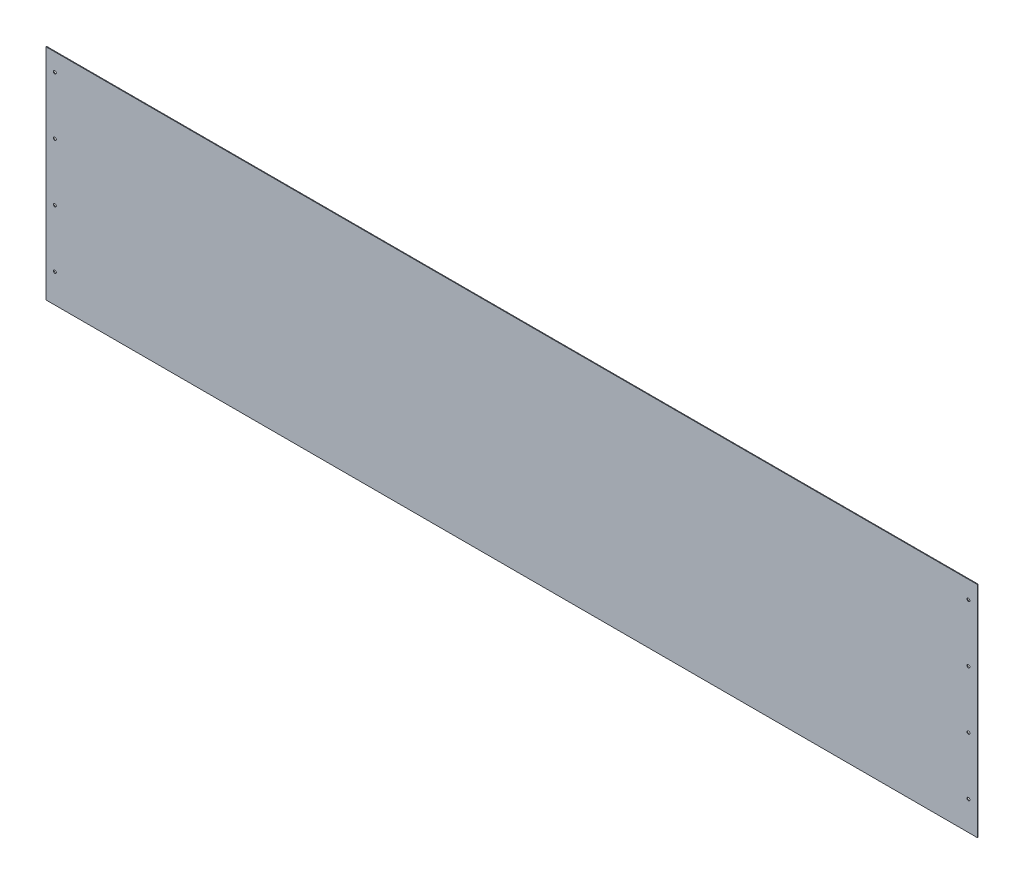
from build123d import *

# Parameters (mm, degrees)
CROQUIS1_W                   = 2103.98
CROQUIS1_H                   = 495.4
BRIDA_BASE1_DEPTH            = 1.5875
TALADRO_DE_MARGEN_PARA_M61_D = 6.6


# Sheet-metal steps are written as plain solids
with BuildPart() as part:
    # Croquis1 → Brida base1 (new body)
    with BuildSketch(Plane.XY):
        Rectangle(CROQUIS1_W, CROQUIS1_H)
    extrude(amount=-BRIDA_BASE1_DEPTH)

    # Taladro de margen para M61 (through all)
    with Locations(Plane(origin=(0, 0, -1.5875), x_dir=(-1, 0, 0), z_dir=(0, 0, -1))):
        with Locations((-1031.99, 207.7), (-1031.99, 77.7), (-1031.99, -52.3), (-1031.99, -182.3), (1031.99, -182.3), (1031.99, -52.3), (1031.99, 77.7), (1031.99, 207.7)):
            Hole(TALADRO_DE_MARGEN_PARA_M61_D / 2)


solid = part.part
